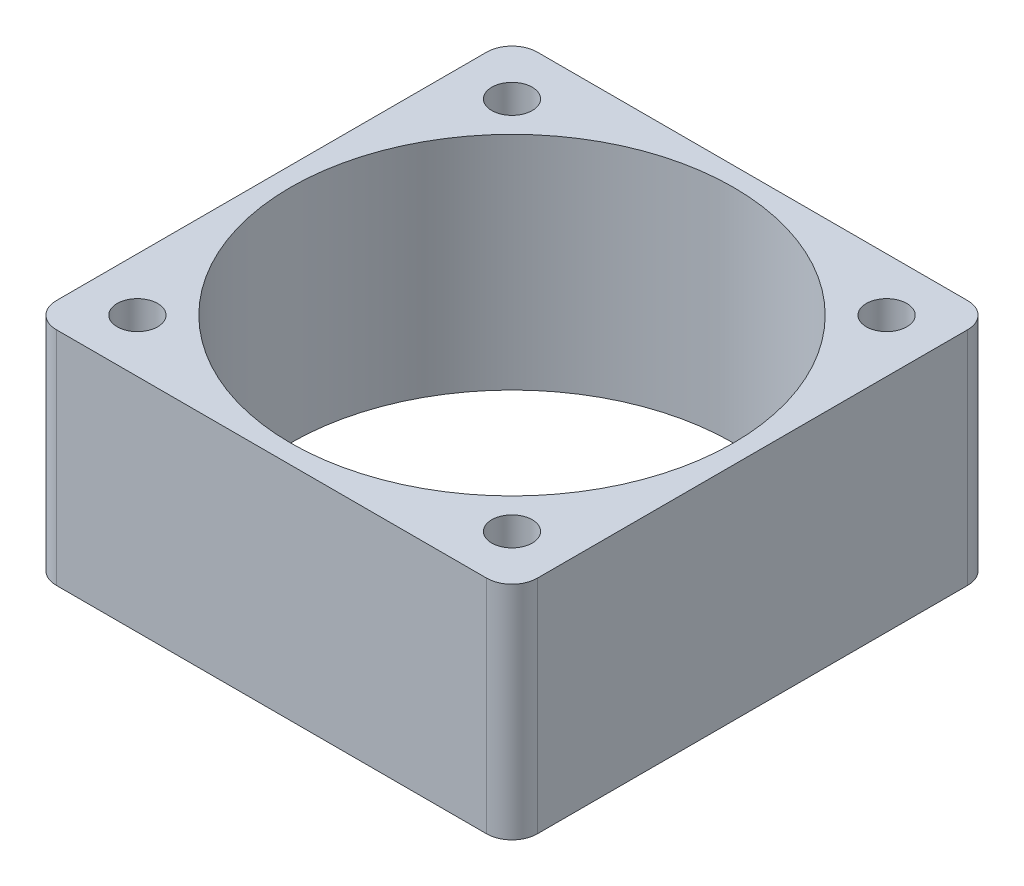
from build123d import *

# Parameters (mm, degrees)
STOCK_MULTIBODY_1_OUTLINE_R   = 1.6
STOCK_MULTIBODY_1_OUTLINE_R_2 = 8.85
STOCK_MULTIBODY_1_DEPTH       = 17.5
CUT_EXTRUDE1_DEPTH            = 33.06633749
CUT_EXTRUDE1_DEPTH_BACK       = 33.06633749
SKETCH1_R                     = 17.5


# Read off the part's stored shape, not the designer's step: Stock-Multibody-1
with BuildPart() as part:
    # Stock-Multibody-1 outline → Stock-Multibody-1 (new body)
    with BuildSketch(Plane(origin=(0, 0, 0), x_dir=(1, 0, 0), z_dir=(0, 1, 0))):
        with BuildLine():
            ThreePointArc((-19, -17), (-18.414213562, -18.414213562), (-17, -19))
            Line((-17, -19), (17, -19))
            ThreePointArc((17, -19), (18.414213562, -18.414213562), (19, -17))
            Line((19, -17), (19, 17))
            ThreePointArc((19, 17), (18.414213562, 18.414213562), (17, 19))
            Line((17, 19), (-17, 19))
            ThreePointArc((-17, 19), (-18.414213562, 18.414213562), (-19, 17))
            Line((-19, 17), (-19, -17))
        make_face()
        with Locations((-14.8, -14.8)):
            Circle(STOCK_MULTIBODY_1_OUTLINE_R, mode=Mode.SUBTRACT)
        with Locations((14.8, -14.8)):
            Circle(STOCK_MULTIBODY_1_OUTLINE_R, mode=Mode.SUBTRACT)
        with Locations((-14.8, 14.8)):
            Circle(STOCK_MULTIBODY_1_OUTLINE_R, mode=Mode.SUBTRACT)
        Circle(STOCK_MULTIBODY_1_OUTLINE_R_2, mode=Mode.SUBTRACT)
        with Locations((14.8, 14.8)):
            Circle(STOCK_MULTIBODY_1_OUTLINE_R, mode=Mode.SUBTRACT)
    extrude(amount=STOCK_MULTIBODY_1_DEPTH)

    # Sketch1 → Cut-Extrude1 (cut, two sides: drawn at the far end of the back side and taken through both)
    with BuildSketch(Plane(origin=(0, 17.5, 0), x_dir=(1, 0, 0), z_dir=(0, 1, 0)).offset(-CUT_EXTRUDE1_DEPTH_BACK)):
        with Locations(Location((0, 0, 0), (0, 0, 270))):
            Circle(SKETCH1_R)
    extrude(amount=CUT_EXTRUDE1_DEPTH + CUT_EXTRUDE1_DEPTH_BACK, mode=Mode.SUBTRACT)


solid = part.part
